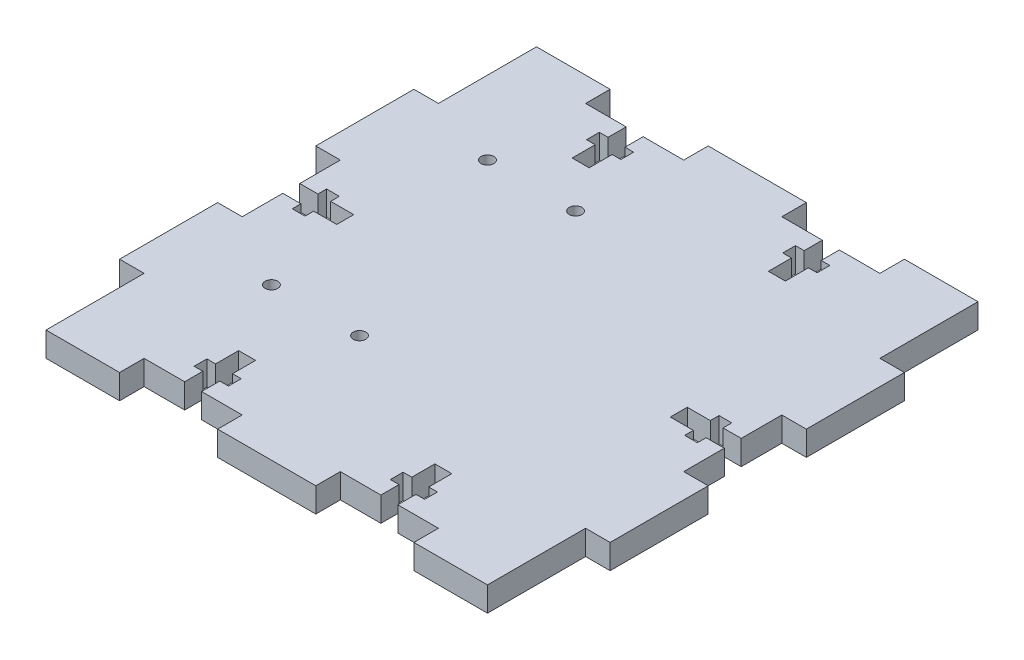
from build123d import *

# Parameters (mm, degrees)
SKETCH1_W                 = 127
SKETCH1_H                 = 127
BOSS_EXTRUDE1_DEPTH       = 6.35
SKETCH2_W                 = 6.35
SKETCH2_H                 = 25.4
CUT_EXTRUDE1_DEPTH        = 6.35
LPATTERN1_COUNT           = 3
LPATTERN1_PITCH           = 50.8
LPATTERN1_COUNT_DIR2      = 2
LPATTERN1_PITCH_DIR2      = 120.65
SKETCH3_W                 = 25.4
SKETCH3_H                 = 6.35
CUT_EXTRUDE2_DEPTH        = 6.35
LPATTERN2_COUNT           = 2
LPATTERN2_PITCH           = 50.8
LPATTERN2_COUNT_DIR2      = 2
LPATTERN2_PITCH_DIR2      = 120.65
SKETCH4_W                 = 13.97
SKETCH4_H                 = 4.3942
SKETCH4_W_2               = 3.302
SKETCH4_H_2               = 8.89
CUT_EXTRUDE3_DEPTH        = 8.89
SKETCH5_W                 = 4.3942
SKETCH5_H                 = 13.97
SKETCH5_W_2               = 8.89
SKETCH5_H_2               = 3.302
CUT_EXTRUDE4_DEPTH        = 30.48
MIRROR3_COPY_1_SKETCH_W   = 4.3942
MIRROR3_COPY_1_SKETCH_H   = 13.97
MIRROR3_COPY_1_SKETCH_W_2 = 8.89
MIRROR3_COPY_1_SKETCH_H_2 = 3.302
MIRROR3_COPY_1_DEPTH      = 30.48
MIRROR3_COPY_2_SKETCH_W   = 4.3942
MIRROR3_COPY_2_SKETCH_H   = 13.97
MIRROR3_COPY_2_SKETCH_W_2 = 8.89
MIRROR3_COPY_2_SKETCH_H_2 = 3.302
MIRROR3_COPY_2_DEPTH      = 30.48
F_4_CLEARANCE_HOLE2_D     = 3.2639
F_4_CLEARANCE_HOLE2_DEPTH = 10.16
F_4_CLEARANCE_HOLE2_TIP   = 0.980574487


with BuildPart() as part:
    # Sketch1 → Boss-Extrude1 (new body)
    with BuildSketch(Plane(origin=(0, 0, 0), x_dir=(1, 0, 0), z_dir=(0, 1, 0))):
        with Locations((63.5, 63.5)):
            Rectangle(SKETCH1_W, SKETCH1_H)
    extrude(amount=BOSS_EXTRUDE1_DEPTH)

    # Sketch2 → Cut-Extrude1 (cut)
    with BuildSketch(Plane(origin=(0, 6.35, 0), x_dir=(1, 0, 0), z_dir=(0, 1, 0))):
        with Locations((3.175, 114.3)):
            Rectangle(SKETCH2_W, SKETCH2_H)
    cut_extrude1 = extrude(amount=-CUT_EXTRUDE1_DEPTH, mode=Mode.SUBTRACT)

    # LPattern1: Cut-Extrude1 3 × 2
    with Locations(*[(j * LPATTERN1_PITCH_DIR2, 0, i * LPATTERN1_PITCH) for i in range(LPATTERN1_COUNT) for j in range(LPATTERN1_COUNT_DIR2) if (i, j) != (0, 0)]):
        add(cut_extrude1, mode=Mode.SUBTRACT)

    # Sketch3 → Cut-Extrude2 (cut)
    with BuildSketch(Plane(origin=(0, 6.35, 0), x_dir=(1, 0, 0), z_dir=(0, 1, 0))):
        with Locations((38.1, 3.175)):
            Rectangle(SKETCH3_W, SKETCH3_H)
    cut_extrude2 = extrude(amount=-CUT_EXTRUDE2_DEPTH, mode=Mode.SUBTRACT)

    # LPattern2: Cut-Extrude2 2 × 2
    with Locations(*[(i * LPATTERN2_PITCH, 0, -j * LPATTERN2_PITCH_DIR2) for i in range(LPATTERN2_COUNT) for j in range(LPATTERN2_COUNT_DIR2) if (i, j) != (0, 0)]):
        add(cut_extrude2, mode=Mode.SUBTRACT)

    # Sketch4 → Cut-Extrude3 (cut)
    with BuildSketch(Plane(origin=(0, 6.35, 0), x_dir=(1, 0, 0), z_dir=(0, 1, 0))):
        with Locations((113.665, 63.5)):
            Rectangle(SKETCH4_W, SKETCH4_H)
        with Locations((114.3, 63.5)):
            Rectangle(SKETCH4_W_2, SKETCH4_H_2)
    cut_extrude3 = extrude(amount=-CUT_EXTRUDE3_DEPTH, mode=Mode.SUBTRACT)

    # Mirror1: Cut-Extrude3 across plane
    add(cut_extrude3.mirror(Plane(origin=(63.5, 0, 0), x_dir=(0, 0, 1), z_dir=(1, 0, 0))), mode=Mode.SUBTRACT)

    # Sketch5 → Cut-Extrude4 (cut)
    with BuildSketch(Plane(origin=(0, 6.35, 0), x_dir=(1, 0, 0), z_dir=(0, 1, 0))):
        with Locations((38.1, 13.335)):
            Rectangle(SKETCH5_W, SKETCH5_H)
        with Locations((38.1, 12.7)):
            Rectangle(SKETCH5_W_2, SKETCH5_H_2)
    cut_extrude4 = extrude(amount=-CUT_EXTRUDE4_DEPTH, mode=Mode.SUBTRACT)

    # Mirror2: Cut-Extrude4 across plane
    add(cut_extrude4.mirror(Plane(origin=(63.5, 0, 0), x_dir=(0, 0, 1), z_dir=(1, 0, 0))), mode=Mode.SUBTRACT)

    # Mirror3 copy 1 sketch → Mirror3 copy 1 (cut)
    with BuildSketch(Plane(origin=(127, 6.35, -127), x_dir=(-1, 0, 0), z_dir=(0, 1, 0))):
        with Locations((38.1, 13.335)):
            Rectangle(MIRROR3_COPY_1_SKETCH_W, MIRROR3_COPY_1_SKETCH_H)
        with Locations((38.1, 12.7)):
            Rectangle(MIRROR3_COPY_1_SKETCH_W_2, MIRROR3_COPY_1_SKETCH_H_2)
    extrude(amount=-MIRROR3_COPY_1_DEPTH, mode=Mode.SUBTRACT)

    # Mirror3 copy 2 sketch → Mirror3 copy 2 (cut)
    with BuildSketch(Plane(origin=(0, 6.35, -127), x_dir=(1, 0, 0), z_dir=(0, 1, 0))):
        with Locations((38.1, -13.335)):
            Rectangle(MIRROR3_COPY_2_SKETCH_W, MIRROR3_COPY_2_SKETCH_H)
        with Locations((38.1, -12.7)):
            Rectangle(MIRROR3_COPY_2_SKETCH_W_2, MIRROR3_COPY_2_SKETCH_H_2)
    extrude(amount=-MIRROR3_COPY_2_DEPTH, mode=Mode.SUBTRACT)

    # #4 Clearance Hole2
    with Locations(Plane(origin=(0, 6.35, 0), x_dir=(1, 0, 0), z_dir=(0, 1, 0))):
        with Locations((25.4, 95.25), (48.2092, 95.25), (48.2092, 39.3192), (25.4, 39.3192)):
            Hole(F_4_CLEARANCE_HOLE2_D / 2, depth=F_4_CLEARANCE_HOLE2_DEPTH)
            with Locations((0, 0, -(F_4_CLEARANCE_HOLE2_DEPTH + F_4_CLEARANCE_HOLE2_TIP / 2))):  # 118° drill point
                Cone(0, F_4_CLEARANCE_HOLE2_D / 2, F_4_CLEARANCE_HOLE2_TIP, mode=Mode.SUBTRACT)


solid = part.part
